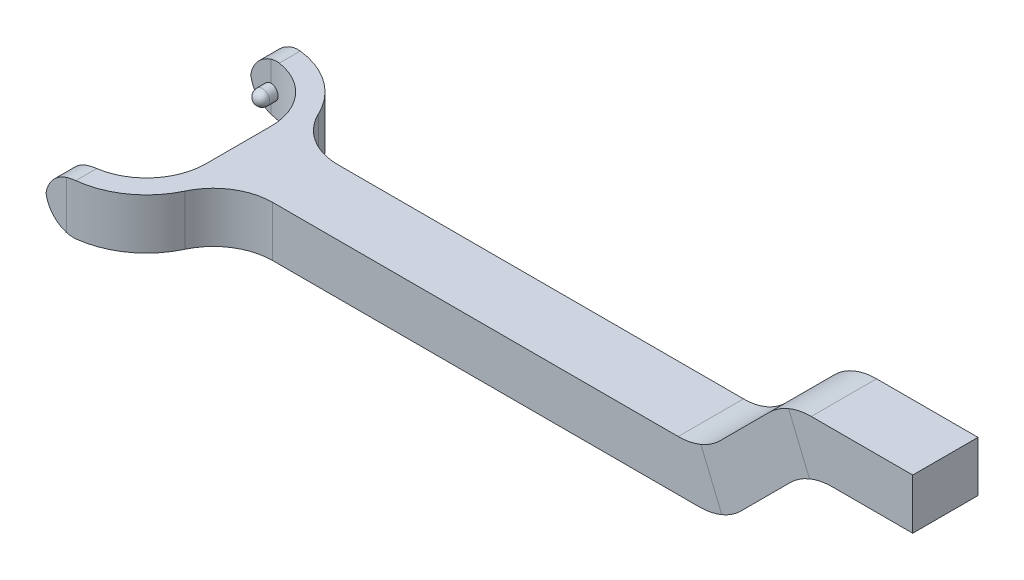
from build123d import *

# Parameters (mm, degrees)
SKETCH1_W           = 11
SKETCH1_H           = 8.5
BOSS_EXTRUDE1_DEPTH = 75
SKETCH14_W          = 11
SKETCH14_H          = 8.5
FILLET1_R           = 10
BOSS_EXTRUDE3_START = -8.5
BOSS_EXTRUDE3_DEPTH = 8.5
FILLET5_R           = 10
FILLET6_R           = 5
SKETCH18_R          = 1.25
BOSS_EXTRUDE4_DEPTH = 1.5
SKETCH19_R          = 1.25
BOSS_EXTRUDE5_DEPTH = 1.5
REVOLVE9_ANGLE      = 180
REVOLVE10_ANGLE     = 180


with BuildPart() as part:
    # Sketch1 → Boss-Extrude1 (new body)
    with BuildSketch(Plane(origin=(0, 0, 0), x_dir=(0, 0, -1), z_dir=(1, 0, 0))):
        with Locations((5.5, -4.25)):
            Rectangle(SKETCH1_W, SKETCH1_H)
    extrude(amount=BOSS_EXTRUDE1_DEPTH)

    # Sweep3: sweep along a curve in space
    with BuildLine() as sweep3_path:
        Line((75, -3, -5.5), (85, -3, -5.5))
        Line((85, -3, -5.5), (99.142135624, 11.142135624, -5.5))
        Line((99.142135624, 11.142135624, -5.5), (119.142135624, 11.142135624, -5.5))
    # Sketch14 → Sweep3 (sweep)
    with BuildSketch(Plane(origin=(75, 0, 0), x_dir=(0, 0, -1), z_dir=(1, 0, 0))):
        with Locations((5.5, -4.25)):
            Rectangle(SKETCH14_W, SKETCH14_H)
    sweep(path=sweep3_path.line, transition=Transition.RIGHT)

    # Fillet1
    fillet1_edges = [part.edges().sort_by_distance(p)[0] for p in [
        (97.899494937, 14.142135624, -5.5),
        (101.420310217, 5.642135624, -5.5),
        (83.757359313, 0, -5.5),
        (87.278174593, -8.5, -5.5),
    ]]
    fillet(fillet1_edges, radius=FILLET1_R)

    # Sketch17 → Boss-Extrude3 (add)
    with BuildSketch(Plane(origin=(0, 0, 0), x_dir=(1, 0, 0), z_dir=(0, 1, 0)).offset(BOSS_EXTRUDE3_START)):
        with BuildLine():
            Line((-10, -10), (-13.5, -10))
            Line((-13.5, -10), (-13.5, -13.5))
            Line((-13.5, -13.5), (-10, -13.5))
            ThreePointArc((-10, -13.5), (-0.454058454, -9.545941546), (3.5, 0))
            Line((3.5, 0), (3.5, 11))
            ThreePointArc((3.5, 11), (-0.454058454, 20.545941546), (-10, 24.5))
            Line((-10, 24.5), (-13.5, 24.5))
            Line((-13.5, 24.5), (-13.5, 21))
            Line((-13.5, 21), (-10, 21))
            ThreePointArc((-10, 21), (-2.928932188, 18.071067812), (0, 11))
            Line((0, 11), (0, 0))
            ThreePointArc((0, 0), (-2.928932188, -7.071067812), (-10, -10))
        make_face()
    extrude(amount=BOSS_EXTRUDE3_DEPTH)

    # Fillet5
    fillet5_edges = [part.edges().sort_by_distance(p)[0] for p in [
        (3.5, -4.25, 0),
        (3.5, -4.25, -11),
    ]]
    fillet(fillet5_edges, radius=FILLET5_R)

    # Fillet6
    # the kernel refuses this fillet: 5 mm, written as the material it takes off along each edge
    with BuildSketch(Plane(origin=(-13.5, -8.5, -2.5), x_dir=(0, 1, 0), z_dir=(0, 0, 1)), Plane(origin=(-13.5, 0, -2.5), x_dir=(1, 0, 0), z_dir=(0, 0, 1)), Plane(origin=(-13.5, -8.5, -37), x_dir=(0, 1, 0), z_dir=(0, 0, 1)), Plane(origin=(-13.5, 0, -37), x_dir=(1, 0, 0), z_dir=(0, 0, 1))) as fillet6_piece_1:
        with BuildLine():
            CenterArc((FILLET6_R, -FILLET6_R), FILLET6_R, 90, 90)
            Line((0, -FILLET6_R), (0, 0))
            Line((0, 0), (FILLET6_R, 0))
        make_face()
    extrude(amount=28.5, mode=Mode.SUBTRACT)

    # Sketch18 → Boss-Extrude4 (add)
    with BuildSketch(Plane.XY.offset(-21)):
        with Locations(Location((-10, -5, 0), (0, 0, 270))):
            Circle(SKETCH18_R)
    extrude(amount=BOSS_EXTRUDE4_DEPTH)

    # Sketch19 → Boss-Extrude5 (add)
    with BuildSketch(Plane(origin=(0, 0, 10), x_dir=(-1, 0, 0), z_dir=(0, 0, -1))):
        with Locations(Location((10, -3.5, 0), (0, 0, 269.999999996))):
            Circle(SKETCH19_R)
    extrude(amount=BOSS_EXTRUDE5_DEPTH)

    # Sketch24 → Revolve9 (revolve)
    with BuildSketch(Plane(origin=(0, 0, 8.5), x_dir=(-1, 0, 0), z_dir=(0, 0, -1))):
        with BuildLine():
            Line((10, -2.25), (10, -4.75))
            ThreePointArc((10, -4.75), (11.25, -3.5), (10, -2.25))
        make_face()
    revolve(axis=Axis((-10, -2.25, 8.5), (0, -1, 0)), revolution_arc=REVOLVE9_ANGLE)

    # Sketch25 → Revolve10 (revolve)
    with BuildSketch(Plane.XY.offset(-19.5)):
        with BuildLine():
            Line((-10, -3.75), (-10, -6.25))
            ThreePointArc((-10, -6.25), (-11.25, -5), (-10, -3.75))
        make_face()
    revolve(axis=Axis((-10, -3.75, -19.5), (0, 1, 0)), revolution_arc=REVOLVE10_ANGLE)


solid = part.part
